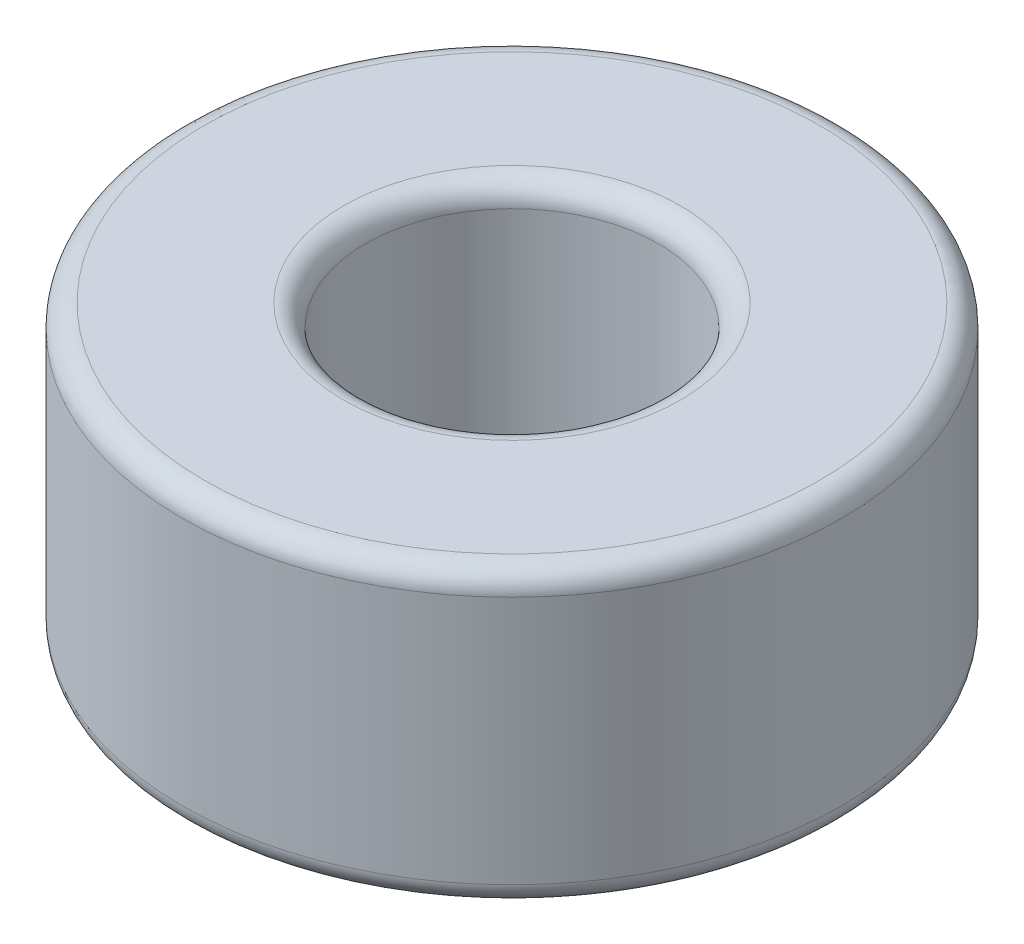
from build123d import *

# Parameters (mm, degrees)
SKETCH_1_R      = 4.5
SKETCH_1_R_2    = 2
EXTRUDE_1_DEPTH = 4
FILLET_1_R      = 0.3


with BuildPart() as part:
    # Эскиз1 → Бобышка-Вытянуть1 (new body)
    with BuildSketch(Plane(origin=(0, 0, 0), x_dir=(1, 0, 0), z_dir=(0, 1, 0))):
        Circle(SKETCH_1_R)
        Circle(SKETCH_1_R_2, mode=Mode.SUBTRACT)
    extrude(amount=EXTRUDE_1_DEPTH)

    # Скругление1
    fillet_1_edges = [part.edges().sort_by_distance(p)[0] for p in [
        (-2, 0, 0),
        (-4.5, 0, 0),
        (-2, 4, 0),
        (-4.5, 4, 0),
    ]]
    fillet(fillet_1_edges, radius=FILLET_1_R)


solid = part.part
